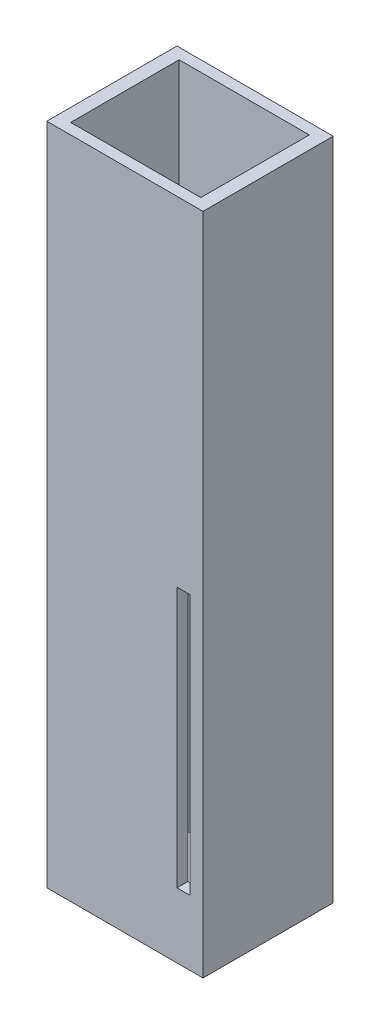
from build123d import *

# Parameters (mm, degrees)
SKETCH1_W               = 6
SKETCH1_H               = 5
SKETCH1_W_2             = 5
SKETCH1_H_2             = 4.166666666
BOSS_EXTRUDE1_DEPTH     = 25.5
CUT_EXTRUDE1_DEPTH      = 27.158172719
CUT_EXTRUDE1_DEPTH_BACK = 27.158172719
SKETCH2_W               = 0.5
SKETCH2_H               = 10
SCALE1_SCALE            = 6


with BuildPart() as part:
    # Sketch1 → Boss-Extrude1 (new body)
    with BuildSketch(Plane(origin=(0, 0, 0), x_dir=(1, 0, 0), z_dir=(0, 1, 0))):
        Rectangle(SKETCH1_W, SKETCH1_H)
        Rectangle(SKETCH1_W_2, SKETCH1_H_2, mode=Mode.SUBTRACT)
    extrude(amount=BOSS_EXTRUDE1_DEPTH)

    # Sketch2 → Cut-Extrude1 (cut, two sides: drawn at the far end of the back side and taken through both)
    with BuildSketch(Plane.XY.offset(2.5).offset(-CUT_EXTRUDE1_DEPTH_BACK)):
        with Locations((2.25, 7.5)):
            Rectangle(SKETCH2_W, SKETCH2_H)
    extrude(amount=CUT_EXTRUDE1_DEPTH + CUT_EXTRUDE1_DEPTH_BACK, mode=Mode.SUBTRACT)


with BuildPart() as part_1:
    # Scale1: scaled about (-0.040834846, 12.845281307, 0)
    add(part.part.scale(SCALE1_SCALE).moved(Location((0.20417423, -64.226406535, 0))))


solid = part_1.part
